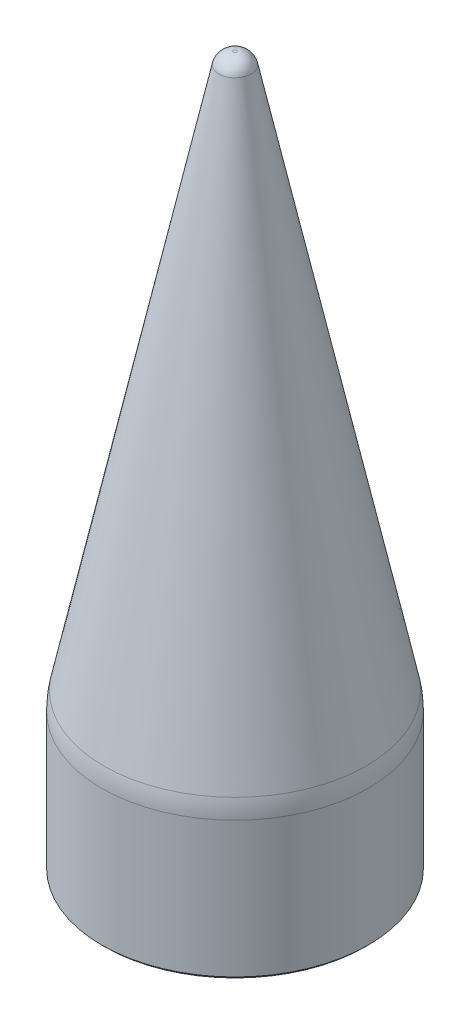
from build123d import *

# Parameters (mm, degrees)
SKETCH_1_R          = 45
EXTRUDE_1_DEPTH     = 50
SKETCH_2_R          = 37.5
CUT_EXTRUDE_1_DEPTH = 50
SKETCH_3_R          = 7.5
EXTRUDE_2_DEPTH     = 80
SKETCH_4_R          = 45
EXTRUDE_3_DEPTH     = 190
EXTRUDE_3_TAPER     = 12
FILLET_1_R          = 5
FILLET_2_R          = 30
CHAMFER_1_SIZE      = 1


with BuildPart() as part:
    # 草图1 → 凸台-拉伸1 (new body)
    with BuildSketch(Plane(origin=(0, 0, 0), x_dir=(1, 0, 0), z_dir=(0, 1, 0))):
        Circle(SKETCH_1_R)
    extrude(amount=EXTRUDE_1_DEPTH)

    # 草图2 → 切除-拉伸1 (cut)
    with BuildSketch(Plane(origin=(0, 0, 0), x_dir=(-1, 0, 0), z_dir=(0, -1, 0))):
        Circle(SKETCH_2_R)
    extrude(amount=-CUT_EXTRUDE_1_DEPTH, mode=Mode.SUBTRACT)

    # 草图3 → 凸台-拉伸2 (add)
    with BuildSketch(Plane.XY.offset(40)):
        with Locations((0, 36.851373129)):
            Circle(SKETCH_3_R)
    extrude(amount=-EXTRUDE_2_DEPTH)

    # 草图4 → 凸台-拉伸3 (add)
    with BuildSketch(Plane(origin=(0, 50, 0), x_dir=(1, 0, 0), z_dir=(0, 1, 0))):
        Circle(SKETCH_4_R)
    extrude(amount=EXTRUDE_3_DEPTH, taper=EXTRUDE_3_TAPER)

    # 圆角1
    fillet_1_edges = [part.edges().sort_by_distance(p)[0] for p in [
        (-4.614253283, 240, 0),
    ]]
    fillet(fillet_1_edges, radius=FILLET_1_R)

    # 圆角2
    fillet_2_edges = [part.edges().sort_by_distance(p)[0] for p in [
        (-45, 50, 0),
    ]]
    fillet(fillet_2_edges, radius=FILLET_2_R)

    # 倒角1
    chamfer_1_edges = [part.edges().sort_by_distance(p)[0] for p in [
        (-45, 0, 0),
        (37.5, 0, 0),
    ]]
    chamfer(chamfer_1_edges, length=CHAMFER_1_SIZE)


solid = part.part
